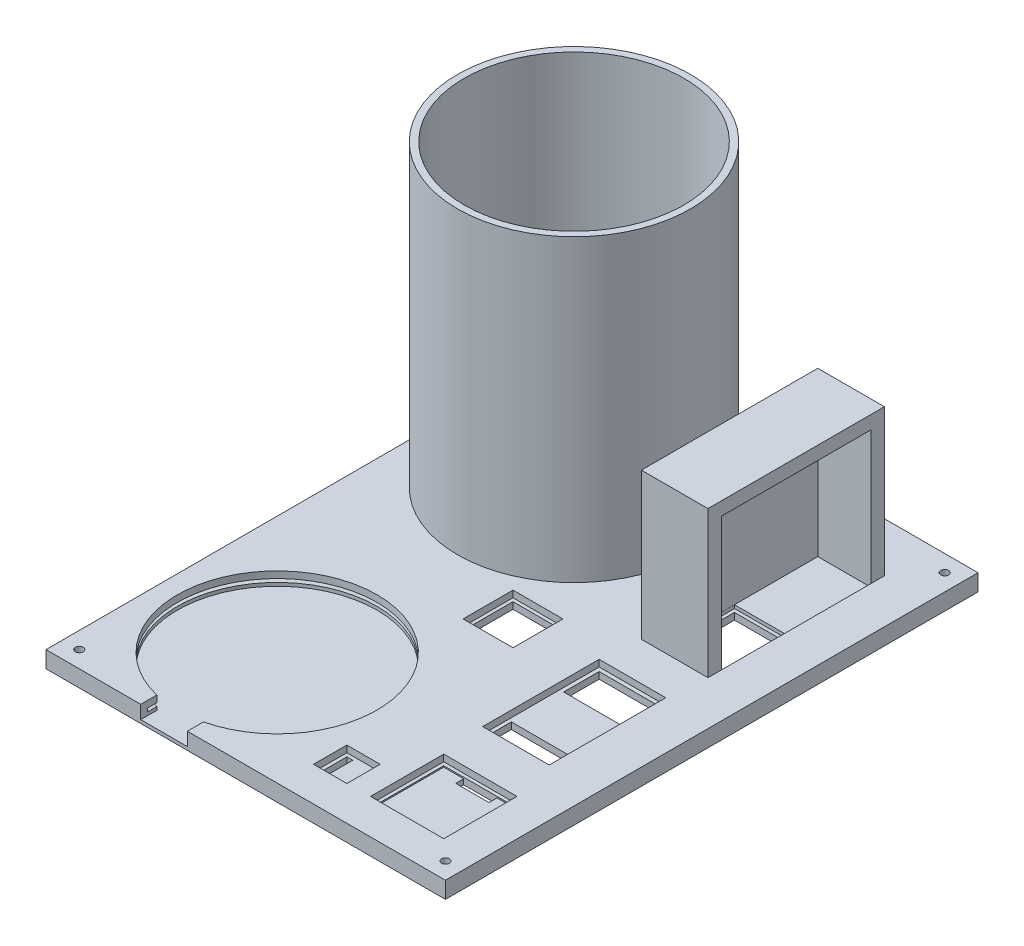
from build123d import *

# Parameters (mm, degrees)
SKETCH1_W           = 152.4
SKETCH1_H           = 203.2
BOSS_EXTRUDE2_DEPTH = 6.35
SKETCH2_R           = 1.5
CUT_EXTRUDE1_DEPTH  = 128.158650905
SKETCH3_R           = 1.5
CUT_EXTRUDE2_DEPTH  = 128.158650905
SKETCH4_R           = 1.5
CUT_EXTRUDE3_DEPTH  = 128.158650905
SKETCH5_R           = 44.45
BOSS_EXTRUDE3_DEPTH = 114.3
SHELL1_START        = 2.54
SHELL1_OUTLINE_R    = 41.91
SHELL1_DEPTH        = 118.11
SHELL1_2_OUTLINE_R  = 41.91
SHELL1_2_DEPTH      = 1.27
SKETCH6_R           = 38.1
CUT_EXTRUDE4_DEPTH  = 5.08
SKETCH7_W           = 17.78
SKETCH7_H           = 18.673076246
CUT_EXTRUDE5_DEPTH  = 5.08
SKETCH8_W           = 19.05
SKETCH8_H           = 19.05
CUT_EXTRUDE6_DEPTH  = 171.861025398
SKETCH9_W           = 27.94
SKETCH9_H           = 27.94
CUT_EXTRUDE7_DEPTH  = 4.318
SKETCH10_W          = 12.7
SKETCH10_H          = 3.048
CUT_EXTRUDE9_DEPTH  = 174.779256311
SKETCH12_W          = 25.4
SKETCH12_H          = 67.31
BOSS_EXTRUDE5_DEPTH = 55.88
SHELL3_START        = 39.044015943
SHELL3_OUTLINE_W    = 52.07
SHELL3_OUTLINE_H    = 57.15
SHELL3_DEPTH        = 20.32
SKETCH13_W          = 20.303180985
SKETCH13_H          = 25.4
CUT_EXTRUDE10_DEPTH = 55.88
SKETCH17_W          = 25.4
SKETCH17_H          = 44.45
CUT_EXTRUDE11_DEPTH = 3.048
SKETCH18_W          = 24.931380967
SKETCH18_H          = 13.519409137
CUT_EXTRUDE12_DEPTH = 10.668
SKETCH19_W          = 25.074639176
SKETCH19_H          = 10.629198189
CUT_EXTRUDE13_DEPTH = 10.668
SKETCH20_W          = 12.7
SKETCH20_H          = 12.7
CUT_EXTRUDE14_DEPTH = 3.048
SKETCH22_W          = 2.266473324
SKETCH22_H          = 12.172894029
CUT_EXTRUDE15_DEPTH = 5.08
SKETCH23_W          = 2.681145579
SKETCH23_H          = 12.278390502
CUT_EXTRUDE16_DEPTH = 5.08


# Read off the part's stored shape, not the designer's step: Shell1, Shell3
with BuildPart() as part:
    # Sketch1 → Boss-Extrude2 (new body)
    with BuildSketch(Plane(origin=(0, 0, 0), x_dir=(1, 0, 0), z_dir=(0, 1, 0))):
        Rectangle(SKETCH1_W, SKETCH1_H)
    extrude(amount=BOSS_EXTRUDE2_DEPTH)

    # Sketch2 → Cut-Extrude1 (cut, through all)
    with BuildSketch(Plane(origin=(0, 6.35, 0), x_dir=(1, 0, 0), z_dir=(0, 1, 0))):
        with Locations(Location((-69.85, 95.25, 0), (0, 0, 270))):
            Circle(SKETCH2_R)
    extrude(amount=-CUT_EXTRUDE1_DEPTH, mode=Mode.SUBTRACT)

    # Sketch3 → Cut-Extrude2 (cut, through all)
    with BuildSketch(Plane(origin=(0, 6.35, 0), x_dir=(1, 0, 0), z_dir=(0, 1, 0))):
        with Locations(Location((69.85, 95.25, 0), (0, 0, 270))):
            Circle(SKETCH3_R)
    extrude(amount=-CUT_EXTRUDE2_DEPTH, mode=Mode.SUBTRACT)

    # Sketch4 → Cut-Extrude3 (cut, through all)
    with BuildSketch(Plane(origin=(0, 6.35, 0), x_dir=(1, 0, 0), z_dir=(0, 1, 0))):
        with Locations(Location((69.85, -95.25, 0), (0, 0, 270))):
            Circle(SKETCH4_R)
        with Locations(Location((-69.85, -95.25, 0), (0, 0, 270))):
            Circle(SKETCH4_R)
    extrude(amount=-CUT_EXTRUDE3_DEPTH, mode=Mode.SUBTRACT)

    # Sketch5 → Boss-Extrude3 (add)
    with BuildSketch(Plane(origin=(0, 6.35, 0), x_dir=(1, 0, 0), z_dir=(0, 1, 0))):
        with Locations(Location((-29.014615541, 52.680103604, 0), (0, 0, 270))):
            Circle(SKETCH5_R)
    extrude(amount=BOSS_EXTRUDE3_DEPTH)

    # Shell1 outline → Shell1 (cut)
    with BuildSketch(Plane(origin=(0, 0, 0), x_dir=(1, 0, 0), z_dir=(0, 1, 0)).offset(SHELL1_START)):
        with Locations((-29.014615541, 52.680103604)):
            Circle(SHELL1_OUTLINE_R)
    extrude(amount=SHELL1_DEPTH, mode=Mode.SUBTRACT)

    # Shell1 2 outline → Shell1 2 (cut)
    # profile 1 of 5: a face of its own
    with BuildSketch(Plane(origin=(0, 0, 0), x_dir=(1, 0, 0), z_dir=(0, 1, 0)).offset(SHELL1_START)):
        with BuildLine():
            ThreePointArc((-68.506311048, 99.06), (-66.993288604, 92.393288604), (-73.66, 93.906311048))
            Line((-73.66, 93.906311048), (-73.66, -93.906311048))
            ThreePointArc((-73.66, -93.906311048), (-66.993288604, -92.393288604), (-68.506311048, -99.06))
            Line((-68.506311048, -99.06), (68.506311048, -99.06))
            ThreePointArc((68.506311048, -99.06), (66.993288604, -92.393288604), (73.66, -93.906311048))
            Line((73.66, -93.906311048), (73.66, 93.906311048))
            ThreePointArc((73.66, 93.906311048), (66.993288604, 92.393288604), (68.506311048, 99.06))
            Line((68.506311048, 99.06), (-68.506311048, 99.06))
        make_face()
        with Locations((-29.014615541, 52.680103604)):
            Circle(SHELL1_2_OUTLINE_R, mode=Mode.SUBTRACT)
    # profile 2 of 5: a face of its own
    with BuildSketch(Plane(origin=(0, 0, 0), x_dir=(1, 0, 0), z_dir=(0, 1, 0)).offset(SHELL1_START)):
        with BuildLine():
            ThreePointArc((-73.66, 96.593688952), (-72.706711396, 98.106711396), (-71.193688952, 99.06))
            Line((-71.193688952, 99.06), (-73.66, 99.06))
            Line((-73.66, 99.06), (-73.66, 96.593688952))
        make_face()
    # profile 3 of 5: a face of its own
    with BuildSketch(Plane(origin=(0, 0, 0), x_dir=(1, 0, 0), z_dir=(0, 1, 0)).offset(SHELL1_START)):
        with BuildLine():
            Line((73.66, 99.06), (71.193688952, 99.06))
            ThreePointArc((71.193688952, 99.06), (72.706711396, 98.106711396), (73.66, 96.593688952))
            Line((73.66, 96.593688952), (73.66, 99.06))
        make_face()
    # profile 4 of 5: a face of its own
    with BuildSketch(Plane(origin=(0, 0, 0), x_dir=(1, 0, 0), z_dir=(0, 1, 0)).offset(SHELL1_START)):
        with BuildLine():
            Line((73.66, -99.06), (73.66, -96.593688952))
            ThreePointArc((73.66, -96.593688952), (72.706711396, -98.106711396), (71.193688952, -99.06))
            Line((71.193688952, -99.06), (73.66, -99.06))
        make_face()
    # profile 5 of 5: a face of its own
    with BuildSketch(Plane(origin=(0, 0, 0), x_dir=(1, 0, 0), z_dir=(0, 1, 0)).offset(SHELL1_START)):
        with BuildLine():
            ThreePointArc((-71.193688952, -99.06), (-72.706711396, -98.106711396), (-73.66, -96.593688952))
            Line((-73.66, -96.593688952), (-73.66, -99.06))
            Line((-73.66, -99.06), (-71.193688952, -99.06))
        make_face()
    extrude(amount=SHELL1_2_DEPTH, mode=Mode.SUBTRACT)

    # Sketch6 → Cut-Extrude4 (cut)
    with BuildSketch(Plane(origin=(0, 6.35, 0), x_dir=(1, 0, 0), z_dir=(0, 1, 0))):
        with Locations(Location((-31.166979336, -58.42, 0), (0, 0, 270))):
            Circle(SKETCH6_R)
    extrude(amount=-CUT_EXTRUDE4_DEPTH, mode=Mode.SUBTRACT)

    # Sketch7 → Cut-Extrude5 (cut)
    with BuildSketch(Plane(origin=(0, 1.27, 0), x_dir=(1, 0, 0), z_dir=(0, 1, 0))):
        with Locations((-31.166979336, -96.52)):
            Rectangle(SKETCH7_W, SKETCH7_H)
    extrude(amount=CUT_EXTRUDE5_DEPTH, mode=Mode.SUBTRACT)

    # Sketch8 → Cut-Extrude6 (cut, through all)
    with BuildSketch(Plane(origin=(0, 6.35, 0), x_dir=(1, 0, 0), z_dir=(0, 1, 0))):
        with Locations((2.757472123, -2.376350246)):
            Rectangle(SKETCH8_W, SKETCH8_H)
    extrude(amount=-CUT_EXTRUDE6_DEPTH, mode=Mode.SUBTRACT)

    # Sketch9 → Cut-Extrude7 (cut)
    with BuildSketch(Plane(origin=(0, 6.35, 0), x_dir=(1, 0, 0), z_dir=(0, 1, 0))):
        with Locations((48.191649932, -74.237208762)):
            Rectangle(SKETCH9_W, SKETCH9_H)
    extrude(amount=-CUT_EXTRUDE7_DEPTH, mode=Mode.SUBTRACT)

    # Sketch10 → Cut-Extrude9 (cut, through all)
    with BuildSketch(Plane(origin=(0, 2.032, 0), x_dir=(1, 0, 0), z_dir=(0, 1, 0))):
        with Locations((48.191649932, -61.791208762)):
            Rectangle(SKETCH10_W, SKETCH10_H)
    extrude(amount=-CUT_EXTRUDE9_DEPTH, mode=Mode.SUBTRACT)

    # Sketch12 → Boss-Extrude5 (add)
    with BuildSketch(Plane(origin=(0, 6.35, 0), x_dir=(1, 0, 0), z_dir=(0, 1, 0))):
        with Locations((46.664015943, 49.057368238)):
            Rectangle(SKETCH12_W, SKETCH12_H)
    extrude(amount=BOSS_EXTRUDE5_DEPTH)

    # Shell3 outline → Shell3 (cut)
    with BuildSketch(Plane.YZ.offset(SHELL3_START)):
        with Locations((31.115, -49.057368238)):
            Rectangle(SHELL3_OUTLINE_W, SHELL3_OUTLINE_H)
    extrude(amount=SHELL3_DEPTH, mode=Mode.SUBTRACT)

    # Sketch13 → Cut-Extrude10 (cut)
    with BuildSketch(Plane(origin=(0, 5.08, 0), x_dir=(1, 0, 0), z_dir=(0, 1, 0))):
        with Locations((49.212425451, 33.146004513)):
            Rectangle(SKETCH13_W, SKETCH13_H)
    extrude(amount=-CUT_EXTRUDE10_DEPTH, mode=Mode.SUBTRACT)

    # Sketch17 → Cut-Extrude11 (cut)
    with BuildSketch(Plane(origin=(0, 6.35, 0), x_dir=(1, 0, 0), z_dir=(0, 1, 0))):
        with Locations((45.24021519, -21.500928879)):
            Rectangle(SKETCH17_W, SKETCH17_H)
    extrude(amount=-CUT_EXTRUDE11_DEPTH, mode=Mode.SUBTRACT)

    # Sketch18 → Cut-Extrude12 (cut)
    with BuildSketch(Plane(origin=(0, 2.54, 0), x_dir=(1, 0, 0), z_dir=(0, 1, 0))):
        with Locations((45.232741318, -6.278596744)):
            Rectangle(SKETCH18_W, SKETCH18_H)
    extrude(amount=-CUT_EXTRUDE12_DEPTH, mode=Mode.SUBTRACT)

    # Sketch19 → Cut-Extrude13 (cut)
    with BuildSketch(Plane(origin=(0, 2.54, 0), x_dir=(1, 0, 0), z_dir=(0, 1, 0))):
        with Locations((45.198109279, -38.227166647)):
            Rectangle(SKETCH19_W, SKETCH19_H)
    extrude(amount=-CUT_EXTRUDE13_DEPTH, mode=Mode.SUBTRACT)

    # Sketch20 → Cut-Extrude14 (cut)
    with BuildSketch(Plane(origin=(0, 6.35, 0), x_dir=(1, 0, 0), z_dir=(0, 1, 0))):
        with Locations((19.089329665, -82.100593314)):
            Rectangle(SKETCH20_W, SKETCH20_H)
    extrude(amount=-CUT_EXTRUDE14_DEPTH, mode=Mode.SUBTRACT)

    # Sketch22 → Cut-Extrude15 (cut)
    with BuildSketch(Plane(origin=(0, 2.54, 0), x_dir=(1, 0, 0), z_dir=(0, 1, 0))):
        with Locations((13.956818217, -81.881158104)):
            Rectangle(SKETCH22_W, SKETCH22_H)
    extrude(amount=-CUT_EXTRUDE15_DEPTH, mode=Mode.SUBTRACT)

    # Sketch23 → Cut-Extrude16 (cut)
    with BuildSketch(Plane(origin=(0, 2.54, 0), x_dir=(1, 0, 0), z_dir=(0, 1, 0))):
        with Locations((23.958869164, -82.026056303)):
            Rectangle(SKETCH23_W, SKETCH23_H)
    extrude(amount=-CUT_EXTRUDE16_DEPTH, mode=Mode.SUBTRACT)


solid = part.part
